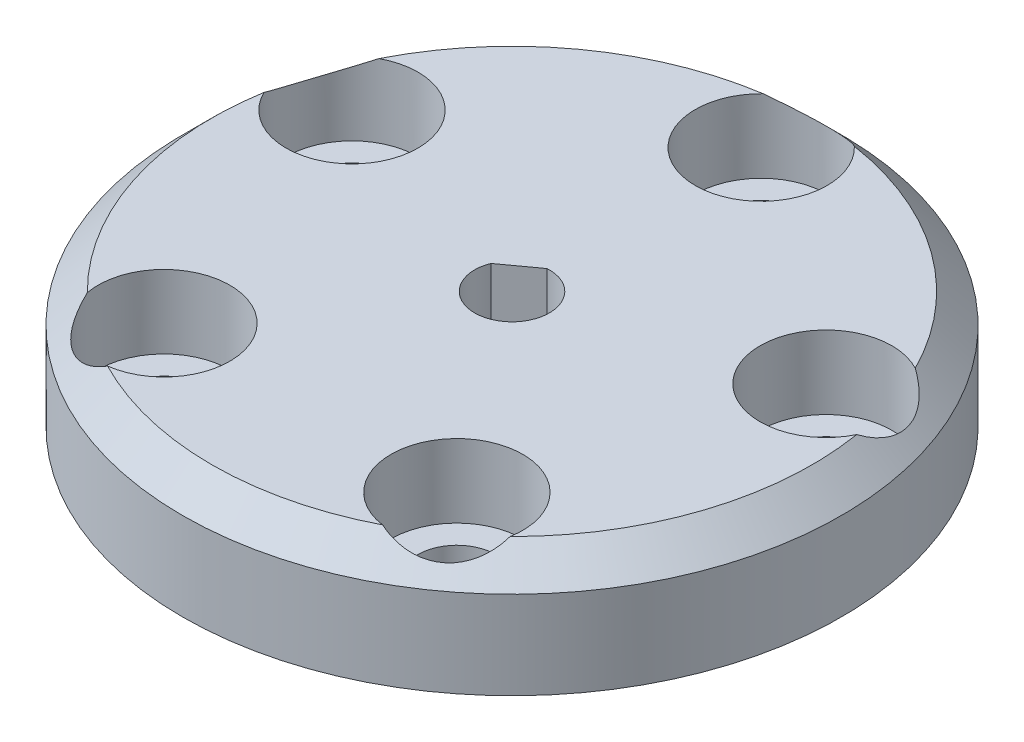
from build123d import *

# Parameters (mm, degrees)
SKETCH1_R           = 22.5
SKETCH1_R_2         = 2.65
BOSS_EXTRUDE1_DEPTH = 8
SKETCH2_R           = 4.5
CUT_EXTRUDE1_DEPTH  = 5
CHAMFER1_SIZE       = 2
CUT_EXTRUDE3_DEPTH  = 33.810059595


with BuildPart() as part:
    # Sketch1 → Boss-Extrude1 (new body)
    with BuildSketch(Plane(origin=(0, 0, 0), x_dir=(1, 0, 0), z_dir=(0, 1, 0))):
        with Locations(Location((0, 0, 0), (0, 0, 270))):
            Circle(SKETCH1_R)
        with Locations(Location((0, 17.013016167, 0), (0, 0, 270))):
            Circle(SKETCH1_R_2, mode=Mode.SUBTRACT)
        with Locations(Location((-16.180339887, 5.257311121, 0), (0, 0, 270))):
            Circle(SKETCH1_R_2, mode=Mode.SUBTRACT)
        with Locations(Location((-10, -13.763819205, 0), (0, 0, 270))):
            Circle(SKETCH1_R_2, mode=Mode.SUBTRACT)
        with Locations(Location((10, -13.763819205, 0), (0, 0, 270))):
            Circle(SKETCH1_R_2, mode=Mode.SUBTRACT)
        with Locations(Location((16.180339887, 5.257311121, 0), (0, 0, 270))):
            Circle(SKETCH1_R_2, mode=Mode.SUBTRACT)
    extrude(amount=BOSS_EXTRUDE1_DEPTH)

    # Sketch2 → Cut-Extrude1 (cut)
    with BuildSketch(Plane(origin=(0, 8, 0), x_dir=(1, 0, 0), z_dir=(0, 1, 0))):
        with Locations(Location((-16.180339887, 5.257311121, 0), (0, 0, 270))):
            Circle(SKETCH2_R)
        with Locations(Location((0, 17.013016167, 0), (0, 0, 270))):
            Circle(SKETCH2_R)
        with Locations(Location((16.180339887, 5.257311121, 0), (0, 0, 270))):
            Circle(SKETCH2_R)
        with Locations(Location((10, -13.763819205, 0), (0, 0, 270))):
            Circle(SKETCH2_R)
        with Locations(Location((-10, -13.763819205, 0), (0, 0, 270))):
            Circle(SKETCH2_R)
    extrude(amount=-CUT_EXTRUDE1_DEPTH, mode=Mode.SUBTRACT)

    # Chamfer1
    # the kernel refuses this chamfer: 2 mm, written as the material it takes off along each edge
    with BuildSketch(Plane(origin=(0, 8, 0), x_dir=(0, 0, 1), z_dir=(-1, 0, 0))) as chamfer1_piece_1:
        Polygon((22.5, -CHAMFER1_SIZE), (22.5 - CHAMFER1_SIZE, 0), (22.5, 0), align=None)
    revolve(axis=Axis((0, 8, 0), (0, 1, 0)), mode=Mode.SUBTRACT)

    # Sketch3 → Cut-Extrude3 (cut, through all)
    with BuildSketch(Plane.XZ):
        with BuildLine():
            Line((-0.154470077, -2.545317072), (-2.373006508, -0.933456004))
            ThreePointArc((-2.373006508, -0.933456004), (1.498852393, 2.062993336), (-0.154470077, -2.545317072))
        make_face()
    extrude(amount=-CUT_EXTRUDE3_DEPTH, mode=Mode.SUBTRACT)


solid = part.part
